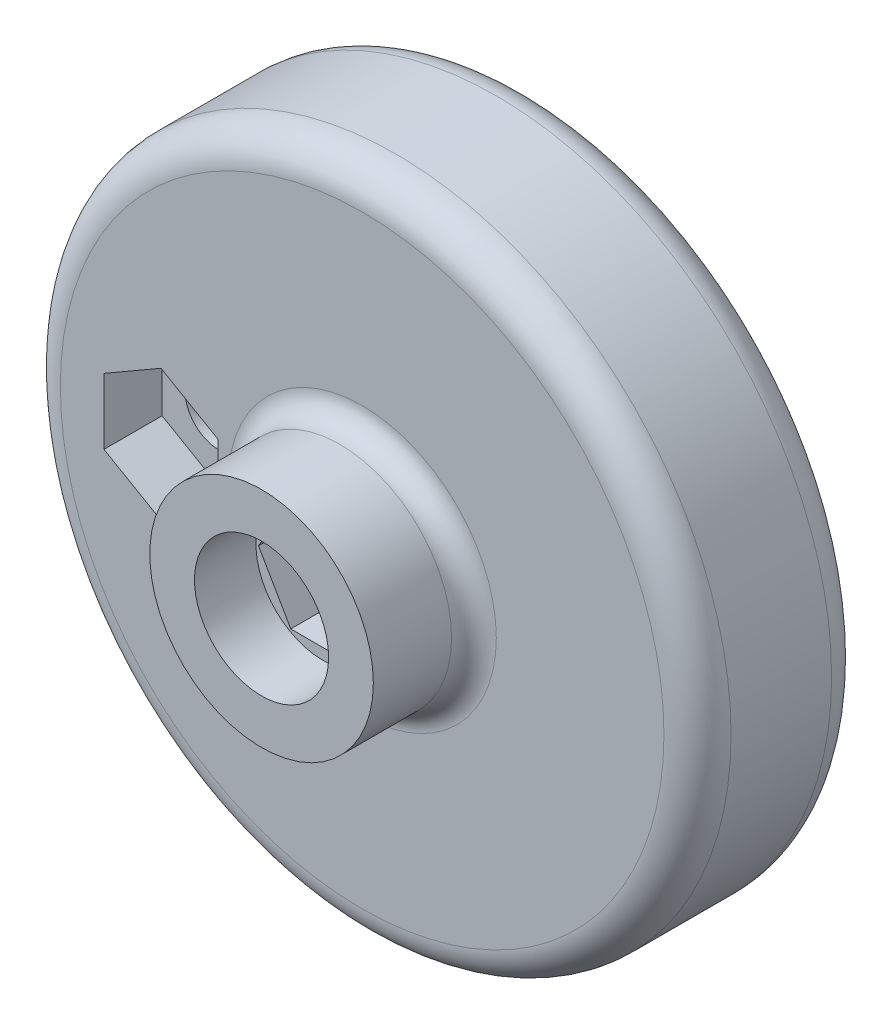
from build123d import *

# Parameters (mm, degrees)
SKETCH1_R           = 30
BOSS_EXTRUDE1_DEPTH = 15
SKETCH2_R           = 10
BOSS_EXTRUDE2_DEPTH = 9
SKETCH3_R           = 3.25
CUT_EXTRUDE1_DEPTH  = 49.744230428
FILLET1_R           = 3
SKETCH8_R           = 3.05
CUT_EXTRUDE3_DEPTH  = 46.000000067
CUT_EXTRUDE4_DEPTH  = 5.2
SKETCH9_R           = 6
CUT_EXTRUDE5_DEPTH  = 5.5
CUT_EXTRUDE6_DEPTH  = 5.5
FILLET2_R           = 2


with BuildPart() as part:
    # Sketch1 → Boss-Extrude1 (new body)
    with BuildSketch(Plane.XY):
        Circle(SKETCH1_R)
    extrude(amount=BOSS_EXTRUDE1_DEPTH)

    # Sketch2 → Boss-Extrude2 (add)
    with BuildSketch(Plane.XY.offset(15)):
        Circle(SKETCH2_R)
    extrude(amount=BOSS_EXTRUDE2_DEPTH)

    # Sketch3 → Cut-Extrude1 (cut, through all)
    with BuildSketch(Plane.XY.offset(24)):
        Circle(SKETCH3_R)
    extrude(amount=-CUT_EXTRUDE1_DEPTH, mode=Mode.SUBTRACT)

    # Fillet1
    fillet1_edges = [part.edges().sort_by_distance(p)[0] for p in [
        (-30, 0, 0),
        (-30, 0, 15),
        (-3.25, 0, 0),
    ]]
    fillet(fillet1_edges, radius=FILLET1_R)

    # Sketch8 → Cut-Extrude3 (cut, through all)
    with BuildSketch(Plane.XY.offset(15)):
        with Locations((-18, 0)):
            Circle(SKETCH8_R)
    extrude(amount=-CUT_EXTRUDE3_DEPTH, mode=Mode.SUBTRACT)

    # Sketch7 → Cut-Extrude4 (cut)
    with BuildSketch(Plane.XY.offset(15)):
        Polygon((-23.1, 2.944486373), (-23.1, -2.944486373), (-18, -5.888972746), (-12.9, -2.944486373), (-12.9, 2.944486373), (-18, 5.888972746), align=None)
    extrude(amount=-CUT_EXTRUDE4_DEPTH, mode=Mode.SUBTRACT)

    # Sketch9 → Cut-Extrude5 (cut)
    with BuildSketch(Plane.XY.offset(24)):
        Circle(SKETCH9_R)
    extrude(amount=-CUT_EXTRUDE5_DEPTH, mode=Mode.SUBTRACT)

    # Sketch10 → Cut-Extrude6 (cut)
    with BuildSketch(Plane.XY.offset(18.5)):
        Polygon((5.773502692, 0), (2.886751346, 5), (-2.886751346, 5), (-5.773502692, 0), (-2.886751346, -5), (2.886751346, -5), align=None)
    extrude(amount=-CUT_EXTRUDE6_DEPTH, mode=Mode.SUBTRACT)

    # Fillet2
    fillet2_edges = [part.edges().sort_by_distance(p)[0] for p in [
        (-10, 0, 15),
    ]]
    fillet(fillet2_edges, radius=FILLET2_R)


solid = part.part
